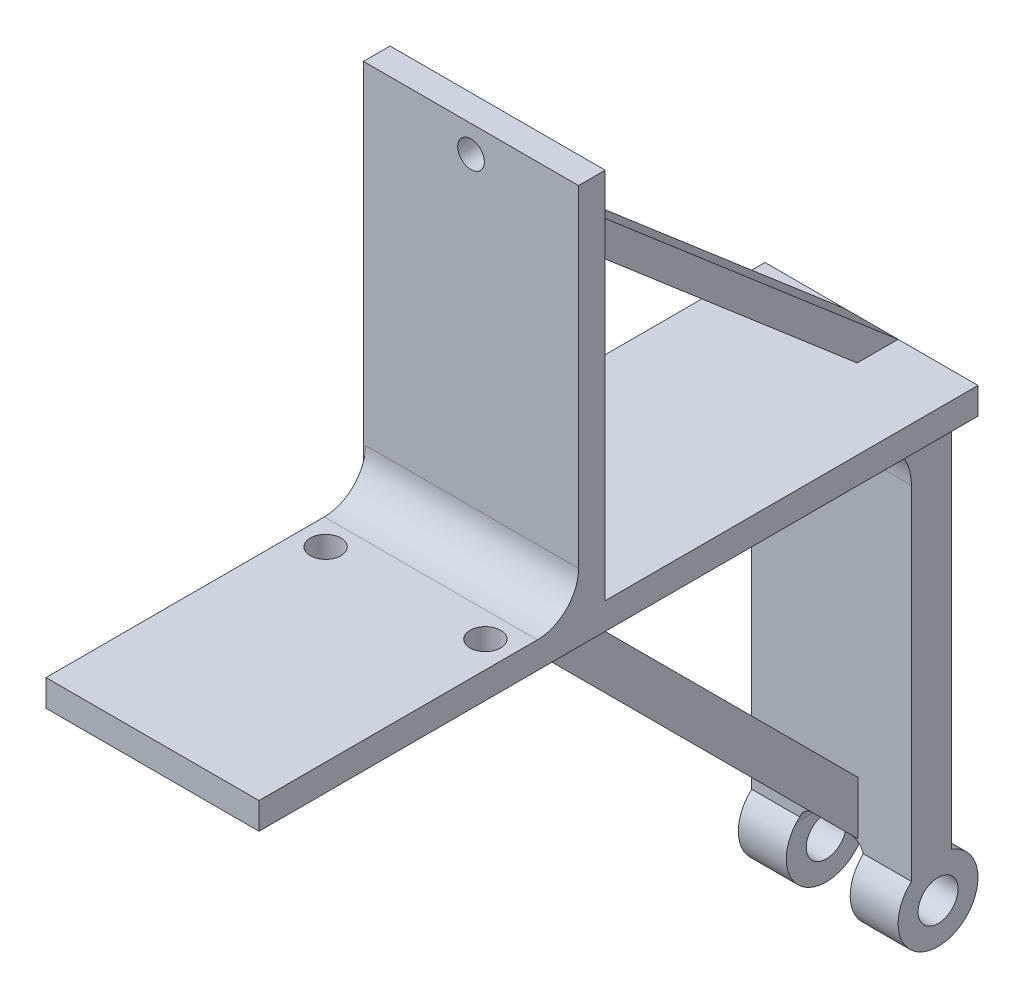
from build123d import *

# Parameters (mm, degrees)
SKETCH2_W                 = 50.8
SKETCH2_H                 = 92.075
BOSS_EXTRUDE1_DEPTH       = 6.35
SKETCH3_W                 = 51.30062604
SKETCH3_H                 = 6.35
BOSS_EXTRUDE2_DEPTH       = 88.9
FILLET1_R                 = 9.8425
SKETCH4_W                 = 50.8
SKETCH4_H                 = 6.35
BOSS_EXTRUDE3_DEPTH       = 38.1
SKETCH7_W                 = 19.05
SKETCH7_H                 = 9.525
BOSS_EXTRUDE4_DEPTH       = 92.075
BOSS_EXTRUDE7_START       = -7.62
SKETCH5_R                 = 9.525
SKETCH5_R_2               = 4.7625
BOSS_EXTRUDE7_DEPTH       = 11.43
BOSS_EXTRUDE8_START       = 7.62
BOSS_EXTRUDE8_DEPTH       = 11.43
SKETCH11_W                = 11.43
SKETCH11_H                = 9.525
BOSS_EXTRUDE9_DEPTH       = 2.425484171
BOSS_EXTRUDE10_DEPTH      = 6.35
BOSS_EXTRUDE10_DEPTH_BACK = 6.35
BOSS_EXTRUDE11_START      = 6.35
BOSS_EXTRUDE11_DEPTH      = 6.35
BOSS_EXTRUDE12_START      = -12.7
BOSS_EXTRUDE12_DEPTH      = 6.35
BOSS_EXTRUDE13_START      = -34.925
SKETCH18_W                = 50.8
SKETCH18_H                = 6.35
BOSS_EXTRUDE13_DEPTH      = 76.2
SKETCH17_R                = 3.657298314
CUT_EXTRUDE4_DEPTH        = 6.35
CUT_EXTRUDE5_DEPTH        = 6.35
BOSS_EXTRUDE14_DEPTH      = 6.35
BOSS_EXTRUDE14_DEPTH_BACK = 6.35
FILLET2_R                 = 12.7
FILLET3_R                 = 3.175


with BuildPart() as part:
    # Sketch2 → Boss-Extrude1 (new body)
    with BuildSketch(Plane(origin=(0, 0, 0), x_dir=(1, 0, 0), z_dir=(0, 1, 0))):
        with Locations((25.4, 46.0375)):
            Rectangle(SKETCH2_W, SKETCH2_H)
    extrude(amount=BOSS_EXTRUDE1_DEPTH)

    # Sketch3 → Boss-Extrude2 (add)
    with BuildSketch(Plane(origin=(0, 6.35, 0), x_dir=(1, 0, 0), z_dir=(0, 1, 0))):
        with Locations((25.14968698, 38.1)):
            Rectangle(SKETCH3_W, SKETCH3_H)
    extrude(amount=BOSS_EXTRUDE2_DEPTH)

    # Fillet1
    fillet1_edges = [part.edges().sort_by_distance(p)[0] for p in [
        (25.4, 6.35, -34.925),
    ]]
    fillet(fillet1_edges, radius=FILLET1_R)

    # Sketch4 → Boss-Extrude3 (add)
    with BuildSketch(Plane(origin=(0, 0, -92.075), x_dir=(-1, 0, 0), z_dir=(0, 0, -1))):
        with Locations((-25.4, 3.175)):
            Rectangle(SKETCH4_W, SKETCH4_H)
    extrude(amount=BOSS_EXTRUDE3_DEPTH)

    # Sketch7 → Boss-Extrude4 (add)
    with BuildSketch(Plane(origin=(0, 0, 0), x_dir=(-1, 0, 0), z_dir=(0, -1, 0))):
        with Locations((-15.875, 125.4125)):
            Rectangle(SKETCH7_W, SKETCH7_H)
        with Locations((-34.925, 125.4125)):
            Rectangle(SKETCH7_W, SKETCH7_H)
    extrude(amount=BOSS_EXTRUDE4_DEPTH)



with BuildPart() as body_2:
    # Sketch5 → Boss-Extrude7 (new body)
    with BuildSketch(Plane(origin=(25.4, 0, 0), x_dir=(0, 0, -1), z_dir=(1, 0, 0)).offset(BOSS_EXTRUDE7_START)):
        with Locations((127, -101.6)):
            Circle(SKETCH5_R)
        with Locations((127, -101.6)):
            Circle(SKETCH5_R_2, mode=Mode.SUBTRACT)
    extrude(amount=-BOSS_EXTRUDE7_DEPTH)


with BuildPart() as body_3:
    # Sketch5<6> → Boss-Extrude8 (new body)
    with BuildSketch(Plane(origin=(25.4, 0, 0), x_dir=(0, 0, -1), z_dir=(1, 0, 0)).offset(BOSS_EXTRUDE8_START)):
        with BuildLine():
            ThreePointArc((127, -92.075), (120.264807909, -94.864807909), (117.475, -101.6))
            Line((117.475, -101.6), (122.2375, -101.6))
            ThreePointArc((122.2375, -101.6), (123.632403955, -98.232403955), (127, -96.8375))
            Line((127, -96.8375), (127, -92.075))
        make_face()
        with BuildLine():
            Line((122.2375, -101.6), (117.475, -101.6))
            ThreePointArc((117.475, -101.6), (127, -111.125), (136.525, -101.6))
            ThreePointArc((136.525, -101.6), (133.735192091, -94.864807909), (127, -92.075))
            Line((127, -92.075), (127, -96.8375))
            ThreePointArc((127, -96.8375), (130.367596045, -98.232403955), (131.7625, -101.6))
            ThreePointArc((131.7625, -101.6), (127, -106.3625), (122.2375, -101.6))
        make_face()
    extrude(amount=BOSS_EXTRUDE8_DEPTH)


with BuildPart() as part_1:
    add(part.part)

    add(body_2.part)  # Boss-Extrude9 merges body 2

    add(body_3.part)  # Boss-Extrude9 merges body 3
    # Sketch11 → Boss-Extrude9 (add)
    with BuildSketch(Plane.XZ.offset(92.075)):
        with Locations((12.065, -125.4125)):
            Rectangle(SKETCH11_W, SKETCH11_H)
        with Locations((38.735, -125.4125)):
            Rectangle(SKETCH11_W, SKETCH11_H)
    extrude(amount=BOSS_EXTRUDE9_DEPTH)

    # Sketch13 → Boss-Extrude10 (add, two sides: drawn at the far end of the back side and taken through both)
    with BuildSketch(Plane(origin=(25.4, 0, 0), x_dir=(0, 0, -1), z_dir=(1, 0, 0)).offset(-BOSS_EXTRUDE10_DEPTH_BACK)):
        Polygon((120.65, -79.375), (41.275, 0), (28.575, 0), (120.65, -92.075), align=None)
    extrude(amount=BOSS_EXTRUDE10_DEPTH + BOSS_EXTRUDE10_DEPTH_BACK)

    # Sketch15 → Boss-Extrude11 (add)
    with BuildSketch(Plane(origin=(25.4, 0, 0), x_dir=(0, 0, -1), z_dir=(1, 0, 0)).offset(BOSS_EXTRUDE11_START)):
        with BuildLine():
            ThreePointArc((12.7, -6.35), (10.840128061, -1.859871939), (6.35, 0))
            ThreePointArc((6.35, 0), (1.859871939, -1.859871939), (0, -6.35))
            Line((0, -6.35), (3.175, -6.35))
            ThreePointArc((3.175, -6.35), (6.35, -3.175), (9.525, -6.35))
            Line((9.525, -6.35), (12.7, -6.35))
        make_face()
        with BuildLine():
            Line((3.175, -6.35), (0, -6.35))
            ThreePointArc((0, -6.35), (6.35, -12.7), (12.7, -6.35))
            Line((12.7, -6.35), (9.525, -6.35))
            ThreePointArc((9.525, -6.35), (6.35, -9.525), (3.175, -6.35))
        make_face()
        with BuildLine():
            Line((6.35, 0), (0, 0))
            Line((0, 0), (0, -6.35))
            ThreePointArc((0, -6.35), (1.859871939, -1.859871939), (6.35, 0))
        make_face()
        with BuildLine():
            Line((12.7, 0), (6.35, 0))
            ThreePointArc((6.35, 0), (10.840128061, -1.859871939), (12.7, -6.35))
            Line((12.7, -6.35), (12.7, 0))
        make_face()
    extrude(amount=BOSS_EXTRUDE11_DEPTH)

    # Sketch15<3> → Boss-Extrude12 (add)
    with BuildSketch(Plane(origin=(25.4, 0, 0), x_dir=(0, 0, -1), z_dir=(1, 0, 0)).offset(BOSS_EXTRUDE12_START)):
        with BuildLine():
            ThreePointArc((12.7, -6.35), (10.840128061, -1.859871939), (6.35, 0))
            ThreePointArc((6.35, 0), (1.859871939, -1.859871939), (0, -6.35))
            Line((0, -6.35), (3.175, -6.35))
            ThreePointArc((3.175, -6.35), (6.35, -3.175), (9.525, -6.35))
            Line((9.525, -6.35), (12.7, -6.35))
        make_face()
        with BuildLine():
            Line((3.175, -6.35), (0, -6.35))
            ThreePointArc((0, -6.35), (6.35, -12.7), (12.7, -6.35))
            Line((12.7, -6.35), (9.525, -6.35))
            ThreePointArc((9.525, -6.35), (6.35, -9.525), (3.175, -6.35))
        make_face()
        with BuildLine():
            Line((6.35, 0), (0, 0))
            Line((0, 0), (0, -6.35))
            ThreePointArc((0, -6.35), (1.859871939, -1.859871939), (6.35, 0))
        make_face()
        with BuildLine():
            Line((12.7, 0), (6.35, 0))
            ThreePointArc((6.35, 0), (10.840128061, -1.859871939), (12.7, -6.35))
            Line((12.7, -6.35), (12.7, 0))
        make_face()
    extrude(amount=BOSS_EXTRUDE12_DEPTH)

    # Sketch18 → Boss-Extrude13 (add)
    with BuildSketch(Plane.XY.offset(BOSS_EXTRUDE13_START)):
        with Locations((25.4, 3.175)):
            Rectangle(SKETCH18_W, SKETCH18_H)
    extrude(amount=BOSS_EXTRUDE13_DEPTH)

    # Sketch17 → Cut-Extrude4 (cut)
    with BuildSketch(Plane(origin=(0, 0, 0), x_dir=(-1, 0, 0), z_dir=(0, -1, 0))):
        with Locations(Location((-44.45, 19.05, 0), (0, 0, 90))):
            Circle(SKETCH17_R)
        with Locations(Location((-6.35, 19.05, 0), (0, 0, 90))):
            Circle(SKETCH17_R)
    extrude(amount=-CUT_EXTRUDE4_DEPTH, mode=Mode.SUBTRACT)

    # Sketch19 → Cut-Extrude5 (cut)
    with BuildSketch(Plane(origin=(0, 0, -41.275), x_dir=(-1, 0, 0), z_dir=(0, 0, -1))):
        with BuildLine():
            ThreePointArc((-28.32468698, 88.9), (-25.14968698, 85.725), (-21.97468698, 88.9))
            Line((-21.97468698, 88.9), (-28.32468698, 88.9))
        make_face()
        with BuildLine():
            Line((-28.32468698, 88.9), (-21.97468698, 88.9))
            ThreePointArc((-21.97468698, 88.9), (-25.14968698, 92.075), (-28.32468698, 88.9))
        make_face()
    extrude(amount=-CUT_EXTRUDE5_DEPTH, mode=Mode.SUBTRACT)

    # Sketch20 → Boss-Extrude14 (add, two sides: drawn at the far end of the back side and taken through both)
    with BuildSketch(Plane(origin=(25.4, 0, 0), x_dir=(0, 0, -1), z_dir=(1, 0, 0)).offset(-BOSS_EXTRUDE14_DEPTH_BACK)):
        Polygon((41.275, 82.55), (130.175, 6.35), (120.417648783, 6.35), (41.275, 74.186556099), align=None)
    extrude(amount=BOSS_EXTRUDE14_DEPTH + BOSS_EXTRUDE14_DEPTH_BACK)

    # Fillet2
    fillet2_edges = [part_1.edges().sort_by_distance(p)[0] for p in [
        (25.4, 0, -120.65),
    ]]
    fillet(fillet2_edges, radius=FILLET2_R)

    # Fillet3
    # the kernel refuses this fillet: 3.175 mm, written as the material it adds along each edge
    with BuildSketch(Plane(origin=(33.02, -92.075, -120.65), x_dir=(-1, 0, 0), z_dir=(0, 0, -1))) as fillet3_piece_1:
        with BuildLine():
            CenterArc((FILLET3_R, -FILLET3_R), FILLET3_R, 90, 90)
            Line((0, -FILLET3_R), (0, 0))
            Line((0, 0), (FILLET3_R, 0))
        make_face()
    extrude(amount=9.525)
    with BuildSketch(Plane(origin=(33.02, -92.075, -112.7125), x_dir=(-1, 0, 0), z_dir=(0, 0, -1))) as fillet3_piece_2_section:
        with BuildLine():
            CenterArc((FILLET3_R, -FILLET3_R), FILLET3_R, 90, 90)
            Line((0, -FILLET3_R), (0, 0))
            Line((0, 0), (FILLET3_R, 0))
        make_face()
    fillet3_piece_2 = extrude(amount=25.4, mode=Mode.PRIVATE)
    fillet3_piece_2 = fillet3_piece_2 & Plane(origin=(33.001906898, -101.6, -127), x_dir=(0, 1, 0), z_dir=(-1, 0, 0)) * Cylinder(9.525, 64, mode=Mode.PRIVATE)
    add(fillet3_piece_2)
    with BuildSketch(Plane(origin=(17.78, -92.075, -120.65), x_dir=(1, 0, 0), z_dir=(0, 0, -1))) as fillet3_piece_3:
        with BuildLine():
            CenterArc((FILLET3_R, FILLET3_R), FILLET3_R, 180, 90)
            Line((0, FILLET3_R), (0, 0))
            Line((0, 0), (FILLET3_R, 0))
        make_face()
    extrude(amount=9.525)
    with BuildSketch(Plane(origin=(17.78, -92.075, -112.7125), x_dir=(1, 0, 0), z_dir=(0, 0, -1))) as fillet3_piece_4_section:
        with BuildLine():
            CenterArc((FILLET3_R, FILLET3_R), FILLET3_R, 180, 90)
            Line((0, FILLET3_R), (0, 0))
            Line((0, 0), (FILLET3_R, 0))
        make_face()
    fillet3_piece_4 = extrude(amount=25.4, mode=Mode.PRIVATE)
    fillet3_piece_4 = fillet3_piece_4 & Plane(origin=(17.798093102, -101.6, -127), x_dir=(0, 0, -1), z_dir=(1, 0, 0)) * Cylinder(9.525, 64, mode=Mode.PRIVATE)
    add(fillet3_piece_4)


solid = part_1.part
